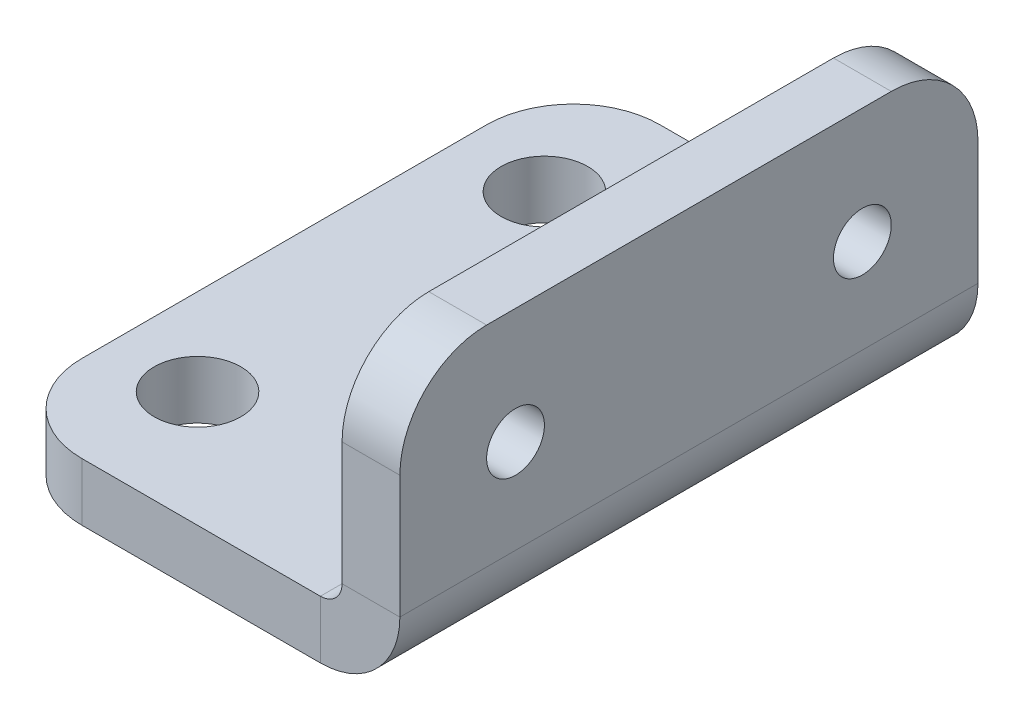
from build123d import *

# Parameters (mm, degrees)
BASE_FLANGE1_DEPTH = 10
FILLET1_R          = 3
SKETCH6_R          = 1.5
CUT_EXTRUDE1_DEPTH = 18.549928775
SKETCH11_R         = 1
CUT_EXTRUDE2_DEPTH = 2


# Sheet-metal steps are written as plain solids
with BuildPart() as part:
    # Sketch1 → Base-Flange1 (new, symmetric)
    with BuildSketch(Plane.XY):
        with BuildLine():
            Line((-12, 0), (-0.75, 0))
            ThreePointArc((-0.75, 0), (-0.219669914, 0.219669914), (0, 0.75))
            Line((0, 0.75), (0, 8))
            Line((0, 8), (2, 8))
            Line((2, 8), (2, 0.75))
            ThreePointArc((2, 0.75), (1.194543648, -1.194543648), (-0.75, -2))
            Line((-0.75, -2), (-12, -2))
            Line((-12, -2), (-12, 0))
        make_face()
    extrude(amount=BASE_FLANGE1_DEPTH, both=True)

    # Fillet1
    fillet1_edges = [part.edges().sort_by_distance(p)[0] for p in [
        (-12, -1, 10),
        (-12, -1, -10),
        (1, 8, 10),
        (1, 8, -10),
    ]]
    fillet(fillet1_edges, radius=FILLET1_R)

    # Sketch6 → Cut-Extrude1 (cut, through all)
    with BuildSketch(Plane(origin=(0, 0, 0), x_dir=(1, 0, 0), z_dir=(0, 1, 0))):
        with Locations(Location((-9, 6, 0), (0, 0, 270))):
            Circle(SKETCH6_R)
        with Locations(Location((-9, -6, 0), (0, 0, 90))):
            Circle(SKETCH6_R)
    extrude(amount=-CUT_EXTRUDE1_DEPTH, mode=Mode.SUBTRACT)

    # Sketch11 → Cut-Extrude2 (cut)
    with BuildSketch(Plane.ZY):
        with Locations((6, 4)):
            Circle(SKETCH11_R)
        with Locations((-6, 4)):
            Circle(SKETCH11_R)
    extrude(amount=-CUT_EXTRUDE2_DEPTH, mode=Mode.SUBTRACT)


solid = part.part
